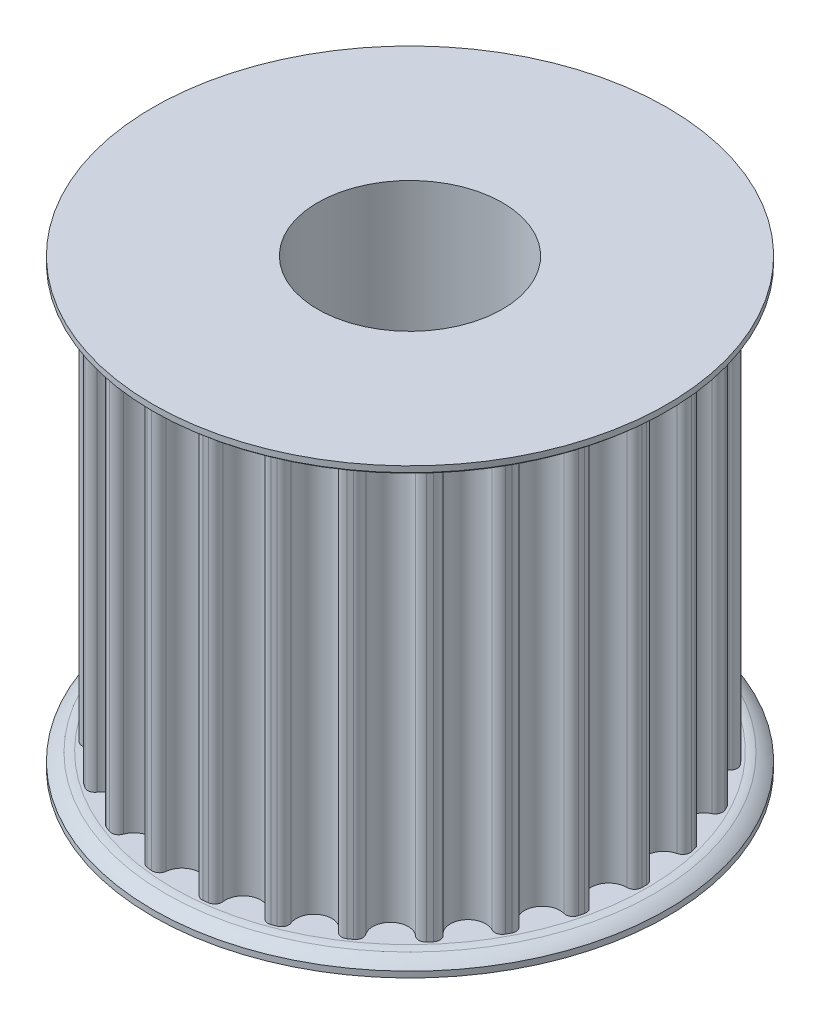
from build123d import *

# Parameters (mm, degrees)
SKETCH1_R          = 20.118642213
TOOTHOD_DEPTH      = 19.05
TOOTHPROFILE_DEPTH = 48.551335722
TOOTHPATTERN_COUNT = 26
BORE_DEPTH         = 37.586694334
BORE_DEPTH_BACK    = 37.586694334
SKETCH7_R          = 7.9375


with BuildPart() as part:
    # Sketch1 → ToothOD (new, symmetric)
    with BuildSketch(Plane(origin=(0, 0, 0), x_dir=(1, 0, 0), z_dir=(0, 1, 0))):
        Circle(SKETCH1_R)
    extrude(amount=TOOTHOD_DEPTH, both=True)

    # Sketch2 → ToothProfile (cut, through all)
    with BuildSketch(Plane(origin=(0, 19.05, 0), x_dir=(1, 0, 0), z_dir=(0, 1, 0))):
        with BuildLine():
            ThreePointArc((-1.517151222, 19.429119817), (0, 18.058642213), (1.517151222, 19.429119817))
            ThreePointArc((1.517151222, 19.429119817), (1.749900865, 19.858779954), (2.218918239, 19.995903739))
            ThreePointArc((2.218918239, 19.995903739), (0, 20.118642213), (-2.218918239, 19.995903739))
            ThreePointArc((-2.218918239, 19.995903739), (-1.749900865, 19.858779954), (-1.517151222, 19.429119817))
        make_face()
    toothprofile = extrude(amount=-TOOTHPROFILE_DEPTH, mode=Mode.SUBTRACT)

    # ToothPattern: ToothProfile ×26 about axis
    toothpattern_axis = Axis((0, 19.05, 0), (0, -1, 0))
    for i in range(1, TOOTHPATTERN_COUNT):
        add(toothprofile.rotate(toothpattern_axis, i * 360 / TOOTHPATTERN_COUNT), mode=Mode.SUBTRACT)

    # Sketch4 → Flange (revolve)
    with BuildSketch(Plane.XY):
        with BuildLine():
            Line((0, -17.78), (20.372642213, -17.78))
            ThreePointArc((20.372642213, -17.78), (20.698398203, -17.805622571), (21.018214541, -17.872637424))
            ThreePointArc((21.018214541, -17.872637424), (21.585943118, -18.154197125), (22.087142213, -18.542))
            Line((22.087142213, -18.542), (22.087142213, -19.05))
            Line((22.087142213, -19.05), (0, -19.05))
            Line((0, -19.05), (0, -17.78))
        make_face()
        with BuildLine():
            Line((22.087142213, 19.05), (22.087142213, 18.542))
            ThreePointArc((22.087142213, 18.542), (21.585943118, 18.154197125), (21.018214541, 17.872637424))
            ThreePointArc((21.018214541, 17.872637424), (20.698398203, 17.805622571), (20.372642213, 17.78))
            Line((20.372642213, 17.78), (0, 17.78))
            Line((0, 17.78), (0, 19.05))
            Line((0, 19.05), (22.087142213, 19.05))
        make_face()
    revolve(axis=Axis((0, 12.09802, 0), (0, -1, 0)))

    # Sketch7 → Bore (cut, two sides: drawn at the far end of the back side and taken through both)
    with BuildSketch(Plane.XZ.offset(-BORE_DEPTH_BACK)):
        Circle(SKETCH7_R)
    extrude(amount=BORE_DEPTH + BORE_DEPTH_BACK, mode=Mode.SUBTRACT)


solid = part.part
